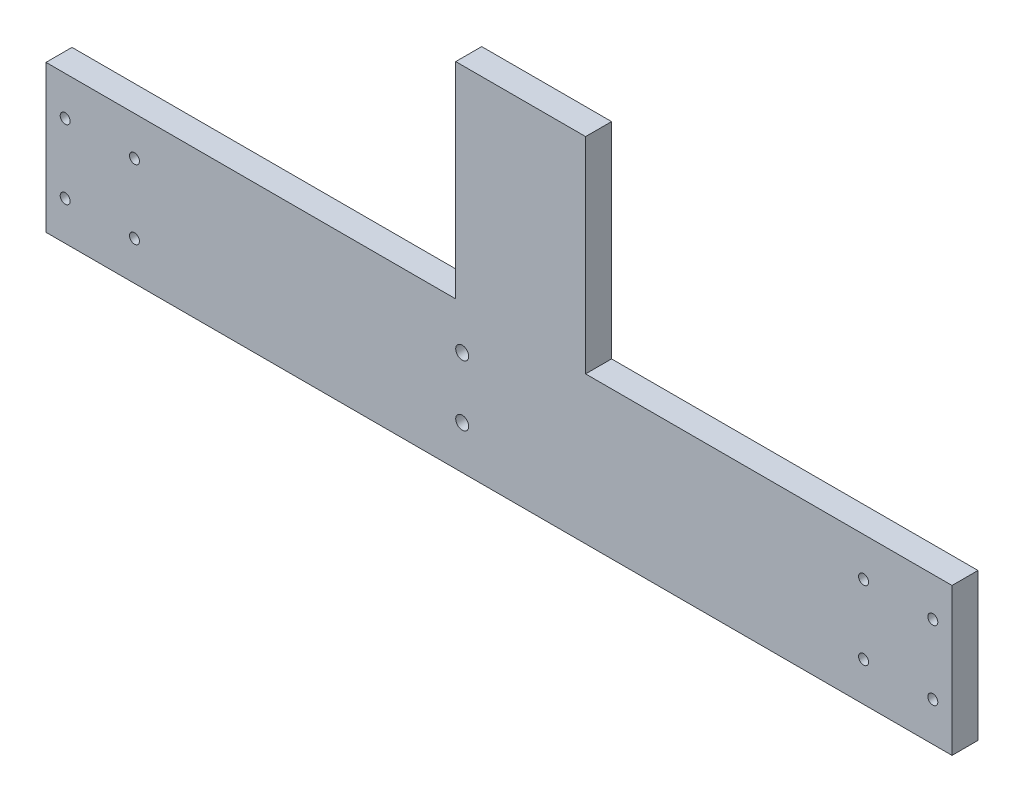
from build123d import *

# Parameters (mm, degrees)
BOSS_EXTRU_1_DEPTH      = 6
ESQUISSE2_R             = 1.15
ESQUISSE2_R_2           = 1.5
ENL_V_MAT_EXTRU_1_DEPTH = 6


with BuildPart() as part:
    # Esquisse1 → Boss.-Extru.1 (new body)
    with BuildSketch(Plane.XY):
        Polygon((-104.63, 17), (-10, 17), (-10, 64.470970022), (20, 64.470970022), (20, 17), (104.63, 17), (104.63, -17), (-104.63, -17), align=None)
    extrude(amount=BOSS_EXTRU_1_DEPTH)

    # Esquisse2 → Enlèv. mat.-Extru.1 (cut)
    with BuildSketch(Plane.XY.offset(6)):
        with Locations((-100.2, 8)):
            Circle(ESQUISSE2_R)
        with Locations((-84.2, 8)):
            Circle(ESQUISSE2_R)
        with Locations((-84.2, -8)):
            Circle(ESQUISSE2_R)
        with Locations((-100.2, -8)):
            Circle(ESQUISSE2_R)
        with Locations((100.2, -8)):
            Circle(ESQUISSE2_R)
        with Locations((84.2, -8)):
            Circle(ESQUISSE2_R)
        with Locations((84.2, 8)):
            Circle(ESQUISSE2_R)
        with Locations((100.2, 8)):
            Circle(ESQUISSE2_R)
        with Locations((-8.5, 7)):
            Circle(ESQUISSE2_R_2)
        with Locations((-8.5, -7)):
            Circle(ESQUISSE2_R_2)
    extrude(amount=-ENL_V_MAT_EXTRU_1_DEPTH, mode=Mode.SUBTRACT)


solid = part.part
